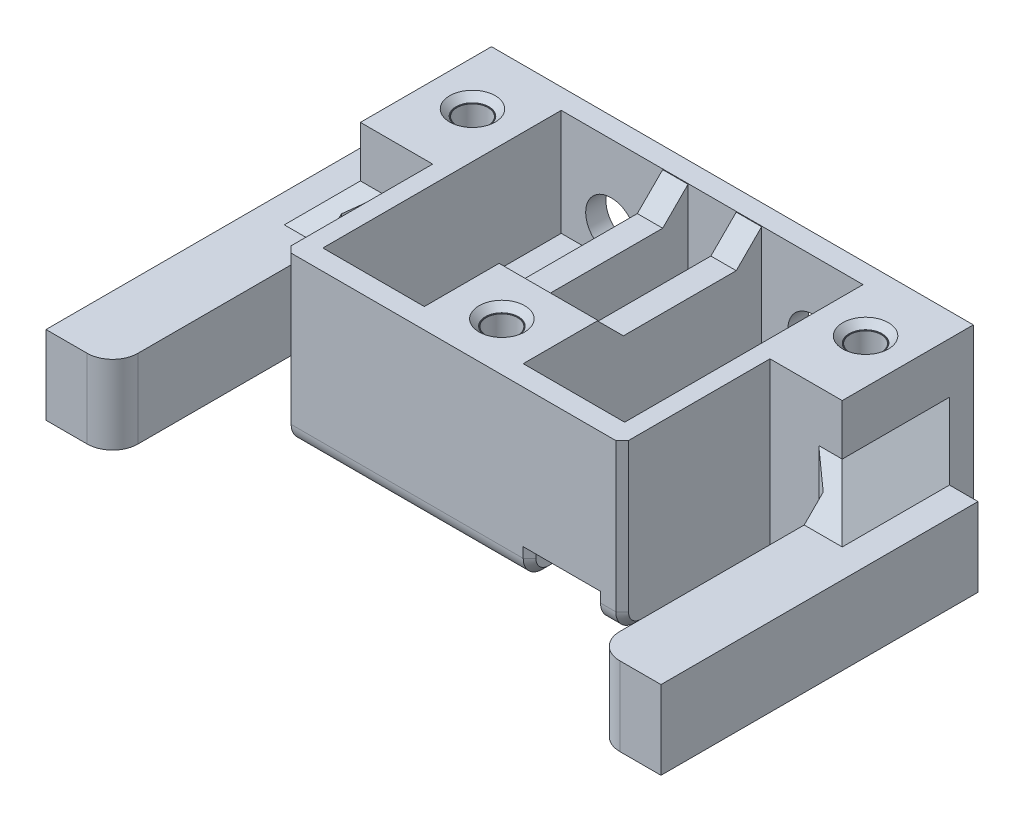
from build123d import *

# Parameters (mm, degrees)
SKETCH1_W                              = 27
SKETCH1_H                              = 22
BOSS_EXTRUDE1_DEPTH                    = 12
SHELL1_T                               = -1.6
SKETCH2_W                              = 2
SKETCH2_H                              = 18.8
BOSS_EXTRUDE2_DEPTH                    = 10.4
SKETCH4_R                              = 2
CUT_EXTRUDE2_DEPTH                     = 9
SKETCH6_W                              = 10.34
SKETCH6_H                              = 12
BOSS_EXTRUDE4_DEPTH                    = 5.5
SKETCH7_W                              = 25
SKETCH7_H                              = 5
BOSS_EXTRUDE5_DEPTH                    = 5.25
CHAMFER1_SIZE                          = 3
SKETCH8_R                              = 2
CUT_EXTRUDE3_DEPTH                     = 33.994744773
CHAMFER2_SIZE                          = 1.5
CHAMFER2_SIZE2                         = 1.852345735
FILLET1_R                              = 2
CHAMFER1_OF_MIRROR1_SIZE               = 3
CHAMFER2_OF_MIRROR1_SIZE2              = 1.5
CHAMFER2_OF_MIRROR1_SIZE               = 1.852345735
FILLET1_OF_MIRROR1_R                   = 2
BOSS_EXTRUDE7_START                    = 1.2
BOSS_EXTRUDE7_DEPTH                    = 1.2
SKETCH13_W                             = 4.5
SKETCH13_H                             = 22
CUT_EXTRUDE5_DEPTH                     = 1
SKETCH17_W                             = 11.66
SKETCH17_H                             = 13.2
CUT_TOLERANCE_FIX_DEPTH                = 0.2
FILLET2_R                              = 1.5
SKETCH18_W                             = 3.8
SKETCH18_H                             = 5.9
BOSS_EXTRUDE8_DEPTH                    = 10.4
SKETCH11_R                             = 2
CUT_EXTRUDE6_DEPTH                     = 10
SKETCH19_W                             = 8
SKETCH19_H                             = 18.8
BOSS_EXTRUDE9_DEPTH                    = 2
SKETCH20_W                             = 4.5
SKETCH20_H                             = 22
CUT_EXTRUDE7_DEPTH                     = 0.1
SKETCH21_W                             = 7.8
SKETCH21_H                             = 12.9
CUT_EXTRUDE8_DEPTH                     = 2.05
CHAMFER4_SIZE                          = 2
CHAMFER5_SIZE                          = 3
TOLERANCE_ADJ_DEPTH                    = 0.6
CHAMFER6_SIZE                          = 0.5
BOSS_EXTRUDE10_START                   = 9.5
SKETCH23_R                             = 2
BOSS_EXTRUDE10_DEPTH                   = 9.5
F_2_45_2_45_DIAMETER_HOLE1_D           = 2.45
F_2_45_2_45_DIAMETER_HOLE1_DEPTH       = 10
F_2_45_2_45_DIAMETER_HOLE1_CSINK_D     = 2.5
F_2_45_2_45_DIAMETER_HOLE1_CSINK_ANGLE = 90
F_2_45_2_45_DIAMETER_HOLE1_TIP         = 0.736054258
CHAMFER7_SIZE                          = 0.7


with BuildPart() as part:
    # Sketch1 → Boss-Extrude1 (new body)
    with BuildSketch(Plane(origin=(0, 0, 0), x_dir=(1, 0, 0), z_dir=(0, 1, 0))):
        Rectangle(SKETCH1_W, SKETCH1_H)
    extrude(amount=BOSS_EXTRUDE1_DEPTH)

    # Shell1
    shell1_openings = [part.faces().sort_by_distance(p)[0] for p in [
        (0, 12, 0),
    ]]
    offset(amount=SHELL1_T, openings=shell1_openings, kind=Kind.INTERSECTION)

    # Sketch2 → Boss-Extrude2 (add)
    with BuildSketch(Plane(origin=(0, 1.6, 0), x_dir=(1, 0, 0), z_dir=(0, 1, 0))):
        with Locations((-2.9, 0)):
            Rectangle(SKETCH2_W, SKETCH2_H)
    boss_extrude2 = extrude(amount=BOSS_EXTRUDE2_DEPTH)

    # Sketch4 → Cut-Extrude2 (cut)
    with BuildSketch(Plane(origin=(0, 0, -11), x_dir=(-1, 0, 0), z_dir=(0, 0, -1))):
        with Locations((7.973688368, 6)):
            Circle(SKETCH4_R)
    cut_extrude2 = extrude(amount=-CUT_EXTRUDE2_DEPTH, mode=Mode.SUBTRACT)

    # Sketch6 → Boss-Extrude4 (add)
    with BuildSketch(Plane.ZY.offset(13.5)):
        with Locations((-5.83, 6)):
            Rectangle(SKETCH6_W, SKETCH6_H)
    boss_extrude4 = extrude(amount=BOSS_EXTRUDE4_DEPTH)

    # Sketch7 → Boss-Extrude5 (add)
    with BuildSketch(Plane.ZY.offset(19)):
        with Locations((6.383608836, 2.5)):
            Rectangle(SKETCH7_W, SKETCH7_H)
    boss_extrude5 = extrude(amount=BOSS_EXTRUDE5_DEPTH)

    # Chamfer1
    chamfer1_edges = [part.edges().sort_by_distance(p)[0] for p in [
        (-19, 2.5, -6.116391164),
    ]]
    chamfer(chamfer1_edges, length=CHAMFER1_SIZE)

    # Sketch8 → Cut-Extrude3 (cut, through all)
    with BuildSketch(Plane(origin=(0, 12, 0), x_dir=(1, 0, 0), z_dir=(0, 1, 0))):
        with Locations(Location((-15.5, 6, 0), (0, 0, 270))):
            Circle(SKETCH8_R)
    cut_extrude3 = extrude(amount=-CUT_EXTRUDE3_DEPTH, mode=Mode.SUBTRACT)

    # Chamfer2
    chamfer2_edges = [part.edges().sort_by_distance(p)[0] for p in [
        (-19, 2.5, -0.66),
    ]]
    chamfer2_side = [part.faces().sort_by_distance(p)[0] for p in [
        (-19, 2.5, 9.111804418),
    ]]
    chamfer(chamfer2_edges, length=CHAMFER2_SIZE, length2=CHAMFER2_SIZE2, reference=chamfer2_side[0])

    # Fillet1
    fillet1_edges = [part.edges().sort_by_distance(p)[0] for p in [
        (-19, 2.5, 18.883608836),
    ]]
    fillet(fillet1_edges, radius=FILLET1_R)

    # Mirror1: Boss-Extrude2, Cut-Extrude2, Boss-Extrude4, Boss-Extrude5, Cut-Extrude3 across plane
    add(boss_extrude2.mirror(Plane.ZY))
    add(cut_extrude2.mirror(Plane.ZY), mode=Mode.SUBTRACT)
    add(boss_extrude4.mirror(Plane.ZY))
    add(boss_extrude5.mirror(Plane.ZY))
    add(cut_extrude3.mirror(Plane.ZY), mode=Mode.SUBTRACT)

    # Chamfer1 of Mirror1
    chamfer1_of_mirror1_edges = [part.edges().sort_by_distance(p)[0] for p in [
        (19, 2.5, -6.116391164),
    ]]
    chamfer(chamfer1_of_mirror1_edges, length=CHAMFER1_OF_MIRROR1_SIZE)

    # Chamfer2 of Mirror1
    chamfer2_of_mirror1_edges = [part.edges().sort_by_distance(p)[0] for p in [
        (19, 2.5, -0.66),
    ]]
    chamfer(chamfer2_of_mirror1_edges, length=CHAMFER2_OF_MIRROR1_SIZE, length2=CHAMFER2_OF_MIRROR1_SIZE2)

    # Fillet1 of Mirror1
    fillet1_of_mirror1_edges = [part.edges().sort_by_distance(p)[0] for p in [
        (19, 2.5, 18.883608836),
    ]]
    fillet(fillet1_of_mirror1_edges, radius=FILLET1_OF_MIRROR1_R)

    # Sketch12 → Boss-Extrude7 (add)
    with BuildSketch(Plane.XZ.offset(BOSS_EXTRUDE7_START)):
        with BuildLine():
            Line((6.6, 11), (-13.5, 11))
            Line((-13.5, 11), (-13.5, -0.66))
            Line((-13.5, -0.66), (-17.147654265, -0.66))
            Line((-17.147654265, -0.66), (-19, 0.84))
            Line((-19, 0.84), (-19, 16.883608836))
            ThreePointArc((-19, 16.883608836), (-19.585786438, 18.297822398), (-21, 18.883608836))
            Line((-21, 18.883608836), (-24.25, 18.883608836))
            Line((-24.25, 18.883608836), (-24.25, -6.116391164))
            Line((-24.25, -6.116391164), (-22, -6.116391164))
            Line((-22, -6.116391164), (-19, -9.116391164))
            Line((-19, -9.116391164), (-19, -11))
            Line((-19, -11), (6.6, -11))
            Line((6.6, -11), (6.6, 11))
        make_face()
        with BuildLine():
            Line((11.1, -11), (11.1, 11))
            Line((11.1, 11), (13.5, 11))
            Line((13.5, 11), (13.5, -0.66))
            Line((13.5, -0.66), (17.147654265, -0.66))
            Line((17.147654265, -0.66), (19, 0.84))
            Line((19, 0.84), (19, 16.883608836))
            ThreePointArc((19, 16.883608836), (19.585786438, 18.297822398), (21, 18.883608836))
            Line((21, 18.883608836), (24.25, 18.883608836))
            Line((24.25, 18.883608836), (24.25, -6.116391164))
            Line((24.25, -6.116391164), (22, -6.116391164))
            Line((22, -6.116391164), (19, -9.116391164))
            Line((19, -9.116391164), (19, -11))
            Line((19, -11), (11.1, -11))
        make_face()
    extrude(amount=-BOSS_EXTRUDE7_DEPTH)

    # Sketch13 → Cut-Extrude5 (cut)
    with BuildSketch(Plane(origin=(0, 0, 0), x_dir=(-1, 0, 0), z_dir=(0, -1, 0))):
        with Locations((-8.85, 0)):
            Rectangle(SKETCH13_W, SKETCH13_H)
    extrude(amount=-CUT_EXTRUDE5_DEPTH, mode=Mode.SUBTRACT)

    # Sketch17 → Cut- tolerance fix (cut)
    with BuildSketch(Plane.ZY.offset(13.5)):
        with Locations((5.17, 5.4)):
            Rectangle(SKETCH17_W, SKETCH17_H)
    cut_tolerance_fix = extrude(amount=-CUT_TOLERANCE_FIX_DEPTH, mode=Mode.SUBTRACT)

    # Mirror2: Cut- tolerance fix across plane
    add(cut_tolerance_fix.mirror(Plane.ZY), mode=Mode.SUBTRACT)

    # Fillet2
    fillet2_edges = [part.edges().sort_by_distance(p)[0] for p in [
        (-3.35, -1.2, 11),
        (12.2, -1.2, 11),
    ]]
    fillet(fillet2_edges, radius=FILLET2_R)

    # Sketch18 → Boss-Extrude8 (add)
    with BuildSketch(Plane(origin=(0, 1.6, 0), x_dir=(1, 0, 0), z_dir=(0, 1, 0))):
        with Locations((0, -6.45)):
            Rectangle(SKETCH18_W, SKETCH18_H)
    extrude(amount=BOSS_EXTRUDE8_DEPTH)

    # Sketch11 → Cut-Extrude6 (cut)
    with BuildSketch(Plane(origin=(0, 12, 0), x_dir=(1, 0, 0), z_dir=(0, 1, 0))):
        with Locations(Location((0, -7.181115317, 0), (0, 0, 270))):
            Circle(SKETCH11_R)
    extrude(amount=-CUT_EXTRUDE6_DEPTH, mode=Mode.SUBTRACT)

    # Sketch19 → Boss-Extrude9 (add)
    with BuildSketch(Plane(origin=(0, 1.6, 0), x_dir=(1, 0, 0), z_dir=(0, 1, 0))):
        with Locations((7.9, 0)):
            Rectangle(SKETCH19_W, SKETCH19_H)
        with Locations((-7.9, 0)):
            Rectangle(SKETCH19_W, SKETCH19_H)
    extrude(amount=BOSS_EXTRUDE9_DEPTH)

    # Sketch20 → Cut-Extrude7 (cut)
    with BuildSketch(Plane.XZ.offset(-1)):
        with Locations((8.85, 0)):
            Rectangle(SKETCH20_W, SKETCH20_H)
    extrude(amount=-CUT_EXTRUDE7_DEPTH, mode=Mode.SUBTRACT)

    # Sketch21 → Cut-Extrude8 (cut)
    with BuildSketch(Plane(origin=(0, 12, 0), x_dir=(1, 0, 0), z_dir=(0, 1, 0))):
        with Locations((0, 2.95)):
            Rectangle(SKETCH21_W, SKETCH21_H)
    extrude(amount=-CUT_EXTRUDE8_DEPTH, mode=Mode.SUBTRACT)

    # Chamfer4
    chamfer4_edges = [part.edges().sort_by_distance(p)[0] for p in [
        (-2.9, 9.95, -9.4),
        (-2.9, 9.95, 3.5),
        (2.9, 9.95, -9.4),
        (2.9, 9.95, 3.5),
    ]]
    chamfer(chamfer4_edges, length=CHAMFER4_SIZE)

    # Chamfer5
    chamfer5_edges = [part.edges().sort_by_distance(p)[0] for p in [
        (19, 5, -4.888195582),
        (18.073827133, 5, -0.66),
        (-19, 5, -4.888195582),
        (-18.073827133, 5, -0.66),
    ]]
    chamfer(chamfer5_edges, length=CHAMFER5_SIZE)

    # Sketch22 → tolerance adj (cut)
    with BuildSketch(Plane(origin=(6.6, 0, 0), x_dir=(0, 0, -1), z_dir=(1, 0, 0))):
        with BuildLine():
            Line((-11, 1.1), (-11, 0.3))
            ThreePointArc((-11, 0.3), (-10.560660172, -0.760660172), (-9.5, -1.2))
            Line((-9.5, -1.2), (11, -1.2))
            Line((11, -1.2), (11, 1.1))
            Line((11, 1.1), (-11, 1.1))
        make_face()
    extrude(amount=-TOLERANCE_ADJ_DEPTH, mode=Mode.SUBTRACT)

    # Chamfer6
    chamfer6_edges = [part.edges().sort_by_distance(p)[0] for p in [
        (-13.3, -1.2, 4.42),
        (13.3, -1.2, 4.42),
        (11.1, -1.2, -0.75),
        (11.1, 0.7, 11),
        (11.1, -0.760660172, 10.560660172),
        (13.3, 6.15, 11),
        (-13.3, 6.15, 11),
        (13.3, -0.760660172, 10.560660172),
        (-13.3, -0.760660172, 10.560660172),
        (6, -1.2, -0.75),
        (6, -0.760660172, 10.560660172),
        (6, 0.7, 11),
    ]]
    chamfer(chamfer6_edges, length=CHAMFER6_SIZE)

    # Sketch23 → Boss-Extrude10 (add)
    with BuildSketch(Plane(origin=(0, 2, 0), x_dir=(1, 0, 0), z_dir=(0, 1, 0)).offset(BOSS_EXTRUDE10_START)):
        with Locations(Location((-15.5, 6, 0), (0, 0, 270))):
            Circle(SKETCH23_R)
        with Locations(Location((15.5, 6, 0), (0, 0, 270))):
            Circle(SKETCH23_R)
        with Locations(Location((0, -7.181115317, 0), (0, 0, 270))):
            Circle(SKETCH23_R)
    extrude(amount=-BOSS_EXTRUDE10_DEPTH)

    # Ø2.45 (2.45) Diameter Hole1
    with Locations(Plane(origin=(0, 11.5, 0), x_dir=(1, 0, 0), z_dir=(0, 1, 0))):
        with Locations((0, -7.181115317), (-15.5, 6), (15.5, 6)):
            CounterSinkHole(F_2_45_2_45_DIAMETER_HOLE1_D / 2, F_2_45_2_45_DIAMETER_HOLE1_CSINK_D / 2, depth=F_2_45_2_45_DIAMETER_HOLE1_DEPTH, counter_sink_angle=F_2_45_2_45_DIAMETER_HOLE1_CSINK_ANGLE)
            with Locations((0, 0, -(F_2_45_2_45_DIAMETER_HOLE1_DEPTH + F_2_45_2_45_DIAMETER_HOLE1_TIP / 2))):  # 118° drill point
                Cone(0, F_2_45_2_45_DIAMETER_HOLE1_D / 2, F_2_45_2_45_DIAMETER_HOLE1_TIP, mode=Mode.SUBTRACT)

    # Chamfer7
    # the kernel refuses this chamfer: 0.7 mm, written as the material it adds along each edge
    with BuildSketch(Plane(origin=(15.5, 11.5, -6), x_dir=(0, 0, 1), z_dir=(-1, 0, 0))) as chamfer7_piece_1_section:
        Polygon((2, CHAMFER7_SIZE), (2 - CHAMFER7_SIZE, 0), (2, 0), align=None)
    chamfer7_piece_1 = revolve(axis=Axis((15.5, 11.5, -6), (0, 1, 0)), mode=Mode.PRIVATE)
    chamfer7_piece_1 = split(chamfer7_piece_1, bisect_by=Plane(origin=(15.5, 12, -7.549927673), z_dir=(0, -1, 0)), keep=Keep.TOP, mode=Mode.PRIVATE)
    add(chamfer7_piece_1)
    with BuildSketch(Plane(origin=(0, 11.5, 7.181115317), x_dir=(0, 0, 1), z_dir=(-1, 0, 0))) as chamfer7_piece_2_section:
        Polygon((2, CHAMFER7_SIZE), (2 - CHAMFER7_SIZE, 0), (2, 0), align=None)
    chamfer7_piece_2 = revolve(axis=Axis((0, 11.5, 7.181115317), (0, 1, 0)), mode=Mode.PRIVATE)
    chamfer7_piece_2 = split(chamfer7_piece_2, bisect_by=Plane(origin=(0, 12, 5.631187644), z_dir=(0, -1, 0)), keep=Keep.TOP, mode=Mode.PRIVATE)
    add(chamfer7_piece_2)
    with BuildSketch(Plane(origin=(-15.5, 11.5, -6), x_dir=(0, 0, 1), z_dir=(-1, 0, 0))) as chamfer7_piece_3_section:
        Polygon((2, CHAMFER7_SIZE), (2 - CHAMFER7_SIZE, 0), (2, 0), align=None)
    chamfer7_piece_3 = revolve(axis=Axis((-15.5, 11.5, -6), (0, 1, 0)), mode=Mode.PRIVATE)
    chamfer7_piece_3 = split(chamfer7_piece_3, bisect_by=Plane(origin=(-15.5, 12, -7.549927673), z_dir=(0, -1, 0)), keep=Keep.TOP, mode=Mode.PRIVATE)
    add(chamfer7_piece_3)


solid = part.part
